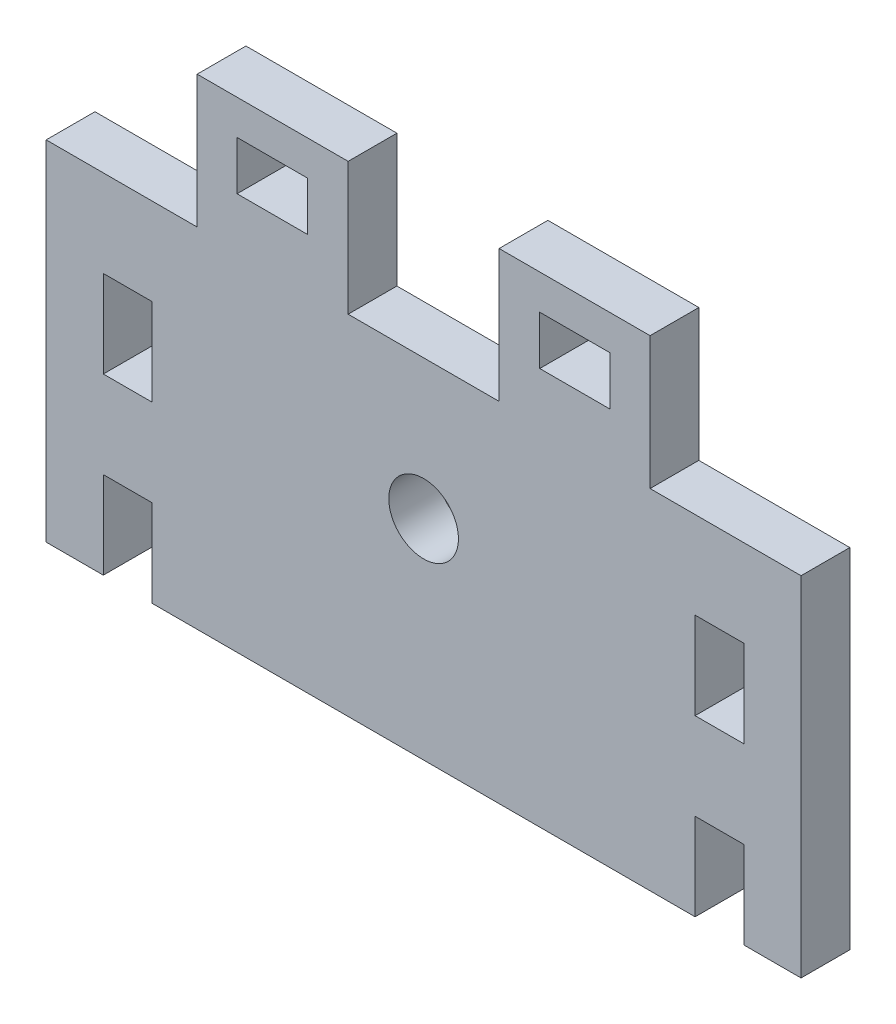
from build123d import *

# Parameters (mm, degrees)
SKETCH1_W                = 82.55
SKETCH1_H                = 43.434
BOSS_EXTRUDE1_DEPTH      = 5.334
CUT_EXTRUDE1_START       = -88.085249325
CUT_EXTRUDE1_OUTLINE_W   = 5.334
CUT_EXTRUDE1_OUTLINE_H   = 5.334
CUT_EXTRUDE1_DEPTH       = 16.51
CUT_EXTRUDE1_START_2     = -55.065249325
CUT_EXTRUDE1_2_OUTLINE_W = 5.334
CUT_EXTRUDE1_2_OUTLINE_H = 5.334
CUT_EXTRUDE1_2_DEPTH     = 16.51
CUT_EXTRUDE1_START_3     = -22.045249325
CUT_EXTRUDE1_3_OUTLINE_W = 5.334
CUT_EXTRUDE1_3_OUTLINE_H = 5.334
CUT_EXTRUDE1_3_DEPTH     = 16.51
SKETCH3_W                = 5.334
SKETCH3_H                = 9.525
CUT_EXTRUDE2_DEPTH       = 93.990910348
SKETCH4_R                = 3.81
CUT_EXTRUDE3_DEPTH       = 93.990910348
SKETCH5_W                = 16.51
SKETCH5_H                = 5.334
BOSS_EXTRUDE2_DEPTH      = 9.144
SKETCH6_W                = 7.700463705
SKETCH6_H                = 5.334
SKETCH6_W_2              = 7.700463706
CUT_EXTRUDE4_DEPTH       = 93.990910348


# Read off the part's stored shape, not the designer's step: Cut-Extrude1
with BuildPart() as part:
    # Sketch1 → Boss-Extrude1 (new body)
    with BuildSketch(Plane.XY):
        with Locations((-46.810249325, -7.606142782)):
            Rectangle(SKETCH1_W, SKETCH1_H)
    extrude(amount=BOSS_EXTRUDE1_DEPTH)

    # Cut-Extrude1 outline → Cut-Extrude1 (cut)
    with BuildSketch(Plane.YZ.offset(CUT_EXTRUDE1_START)):
        with Locations((11.443857218, 2.667)):
            Rectangle(CUT_EXTRUDE1_OUTLINE_W, CUT_EXTRUDE1_OUTLINE_H)
    extrude(amount=CUT_EXTRUDE1_DEPTH, mode=Mode.SUBTRACT)

    # Cut-Extrude1 2 outline → Cut-Extrude1 2 (cut)
    with BuildSketch(Plane.YZ.offset(CUT_EXTRUDE1_START_2)):
        with Locations((11.443857218, 2.667)):
            Rectangle(CUT_EXTRUDE1_2_OUTLINE_W, CUT_EXTRUDE1_2_OUTLINE_H)
    extrude(amount=CUT_EXTRUDE1_2_DEPTH, mode=Mode.SUBTRACT)

    # Cut-Extrude1 3 outline → Cut-Extrude1 3 (cut)
    with BuildSketch(Plane.YZ.offset(CUT_EXTRUDE1_START_3)):
        with Locations((11.443857218, 2.667)):
            Rectangle(CUT_EXTRUDE1_3_OUTLINE_W, CUT_EXTRUDE1_3_OUTLINE_H)
    extrude(amount=CUT_EXTRUDE1_3_DEPTH, mode=Mode.SUBTRACT)

    # Sketch3 → Cut-Extrude2 (cut, through all)
    with BuildSketch(Plane.XY.offset(5.334)):
        with Locations((-79.166667411, -24.560642782)):
            Rectangle(SKETCH3_W, SKETCH3_H)
        with Locations((-79.166667411, -5.510642782)):
            Rectangle(SKETCH3_W, SKETCH3_H)
        with Locations((-14.453831238, -5.510642782)):
            Rectangle(SKETCH3_W, SKETCH3_H)
        with Locations((-14.453831238, -24.560642782)):
            Rectangle(SKETCH3_W, SKETCH3_H)
    extrude(amount=-CUT_EXTRUDE2_DEPTH, mode=Mode.SUBTRACT)

    # Sketch4 → Cut-Extrude3 (cut, through all)
    with BuildSketch(Plane.XY.offset(5.334)):
        with Locations((-46.810249325, -6.463142782)):
            Circle(SKETCH4_R)
    extrude(amount=-CUT_EXTRUDE3_DEPTH, mode=Mode.SUBTRACT)

    # Sketch5 → Boss-Extrude2 (add)
    with BuildSketch(Plane(origin=(0, 14.110857218, 0), x_dir=(1, 0, 0), z_dir=(0, 1, 0))):
        with Locations((-63.320249325, -2.667)):
            Rectangle(SKETCH5_W, SKETCH5_H)
        with Locations((-30.300249325, -2.667)):
            Rectangle(SKETCH5_W, SKETCH5_H)
    extrude(amount=BOSS_EXTRUDE2_DEPTH)

    # Sketch6 → Cut-Extrude4 (cut, through all)
    with BuildSketch(Plane.XY.offset(5.334)):
        with Locations((-63.360481178, 16.777857218)):
            Rectangle(SKETCH6_W, SKETCH6_H)
        with Locations((-30.260017472, 16.777857218)):
            Rectangle(SKETCH6_W_2, SKETCH6_H)
    extrude(amount=-CUT_EXTRUDE4_DEPTH, mode=Mode.SUBTRACT)


solid = part.part
